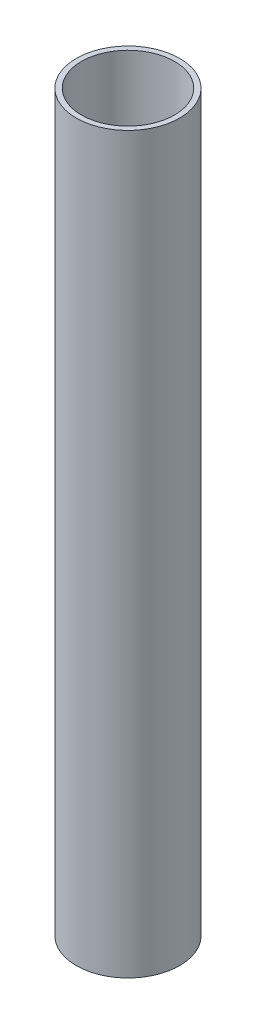
from build123d import *

# Parameters (mm, degrees)
SKETCH1_R           = 10
SKETCH1_R_2         = 9
BOSS_EXTRUDE1_DEPTH = 142


with BuildPart() as part:
    # Sketch1 → Boss-Extrude1 (new body)
    with BuildSketch(Plane(origin=(0, 0, 0), x_dir=(1, 0, 0), z_dir=(0, 1, 0))):
        Circle(SKETCH1_R)
        Circle(SKETCH1_R_2, mode=Mode.SUBTRACT)
    extrude(amount=BOSS_EXTRUDE1_DEPTH)


solid = part.part
